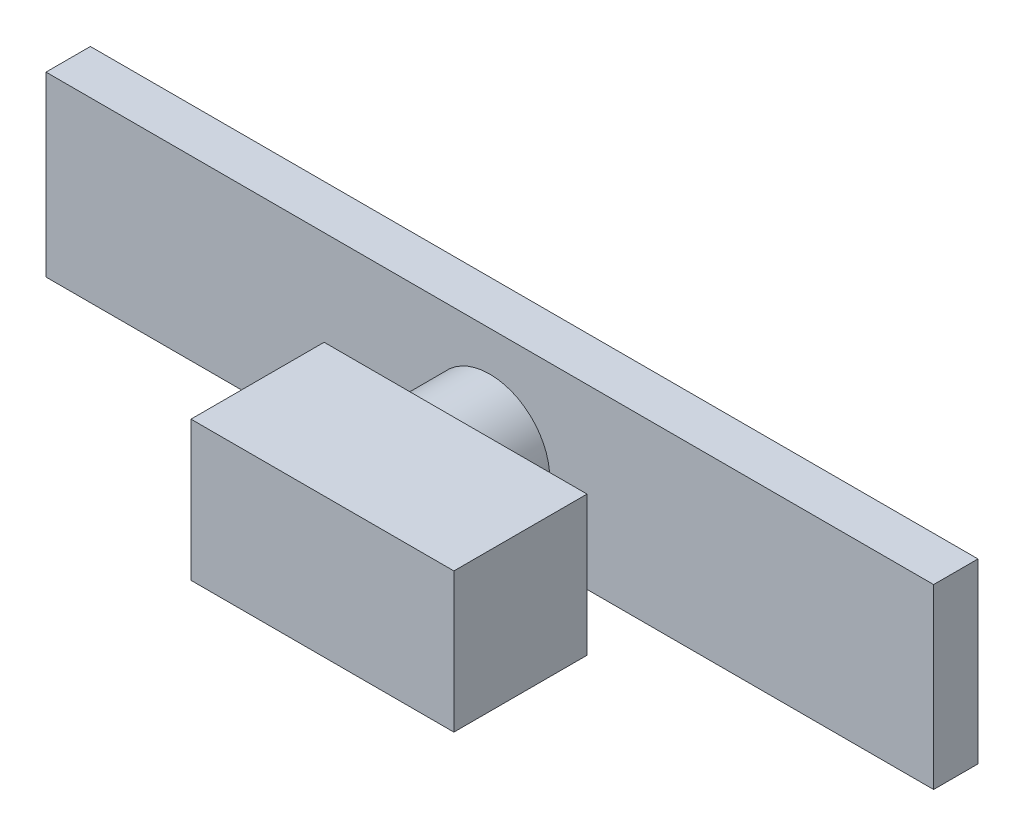
from build123d import *

# Parameters (mm, degrees)
SKETCH2_W             = 254
SKETCH2_H             = 12.7
BOSS_EXTRUDE1_DEPTH   = 50.8
SKETCH3_R             = 17.140791438
BOSS_EXTRUDE2_DEPTH   = 19.05
SKETCH4_W             = 75.235944222
SKETCH4_H             = 39.955088207
BOSS_EXTRUDE3_DEPTH   = 38.1
SCALE2_SCALE          = 0.06
BODY_MOVE_COPY1_ANGLE = 90
SCALE5_SCALE          = 0.25


with BuildPart() as part:
    # Sketch2 → Boss-Extrude1 (new body)
    with BuildSketch(Plane.XY):
        with Locations((79.130769231, 14.898076923)):
            Rectangle(SKETCH2_W, SKETCH2_H)
    extrude(amount=BOSS_EXTRUDE1_DEPTH)

    # Sketch3 → Boss-Extrude2 (add)
    with BuildSketch(Plane(origin=(0, 21.248076923, 0), x_dir=(1, 0, 0), z_dir=(0, 1, 0))):
        with Locations((79.130769231, -28.483063876)):
            Circle(SKETCH3_R)
    extrude(amount=BOSS_EXTRUDE2_DEPTH)

    # Sketch4 → Boss-Extrude3 (add)
    with BuildSketch(Plane(origin=(0, 40.298076923, 0), x_dir=(1, 0, 0), z_dir=(0, 1, 0))):
        with Locations((88.38546847, -28.088530296)):
            Rectangle(SKETCH4_W, SKETCH4_H)
    extrude(amount=BOSS_EXTRUDE3_DEPTH)


with BuildPart() as part_1:
    # Scale2: scaled about (82.711857342, 33.041003565, 26.623476887)
    add(part.part.scale(SCALE2_SCALE).moved(Location((77.749145901, 31.058543351, 25.026068274))))


with BuildPart() as part_2:
    # Body-Move/Copy1: moved
    add(part_1.part.rotate(Axis((0, 33.666927966, 26.550068274), (1, 0, 0)), BODY_MOVE_COPY1_ANGLE))


with BuildPart() as part_3:
    # Body-Move/Copy3: moved
    add(part_2.part.moved(Location((-50.8, 0, -50.8))))


with BuildPart() as part_4:
    # Scale5: scaled about (31.911857342, 33.593519353, -24.875856127)
    add(part_3.part.scale(SCALE5_SCALE).moved(Location((23.933893006, 25.195139515, -18.656892095))))


with BuildPart() as part_5:
    # Body-Move/Copy9: moved
    add(part_4.part.moved(Location((-50.8, 0, 0))))


with BuildPart() as part_6:
    # z down: moved
    add(part_5.part.moved(Location((0, 0, -25.4))))


solid = part_6.part
